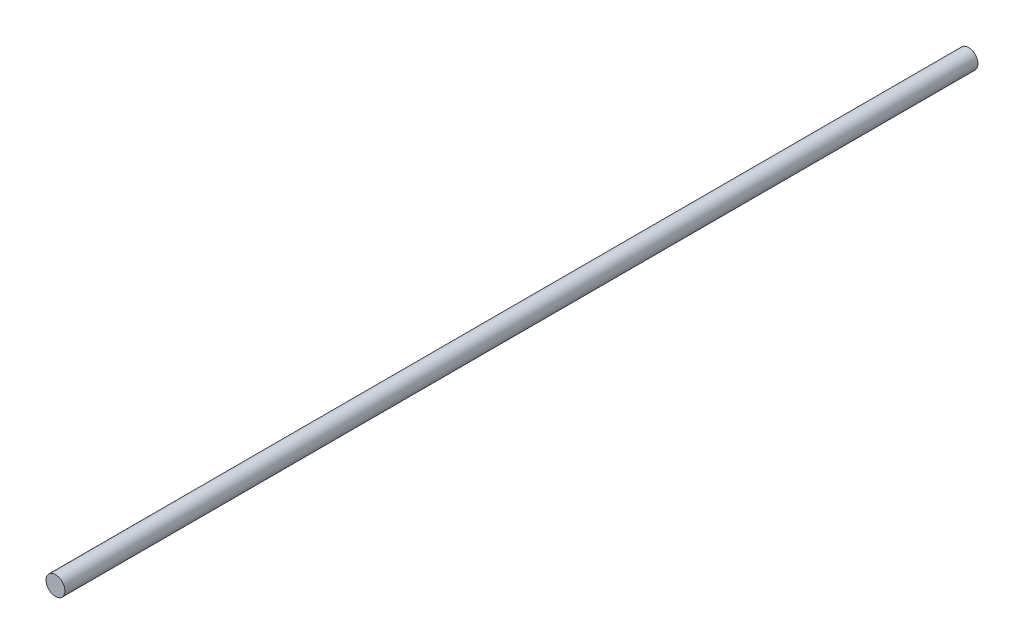
from build123d import *

# Parameters (mm, degrees)
SKETCH2_W = 385
SKETCH2_H = 4


with BuildPart() as part:
    # Sketch2 → Revolve1 (revolve)
    with BuildSketch(Plane(origin=(0, 0, 0), x_dir=(0, 0, -1), z_dir=(1, 0, 0))):
        with Locations((192.5, 2)):
            Rectangle(SKETCH2_W, SKETCH2_H)
    revolve(axis=Axis((0, 0, 0), (0, 0, -1)))


solid = part.part
